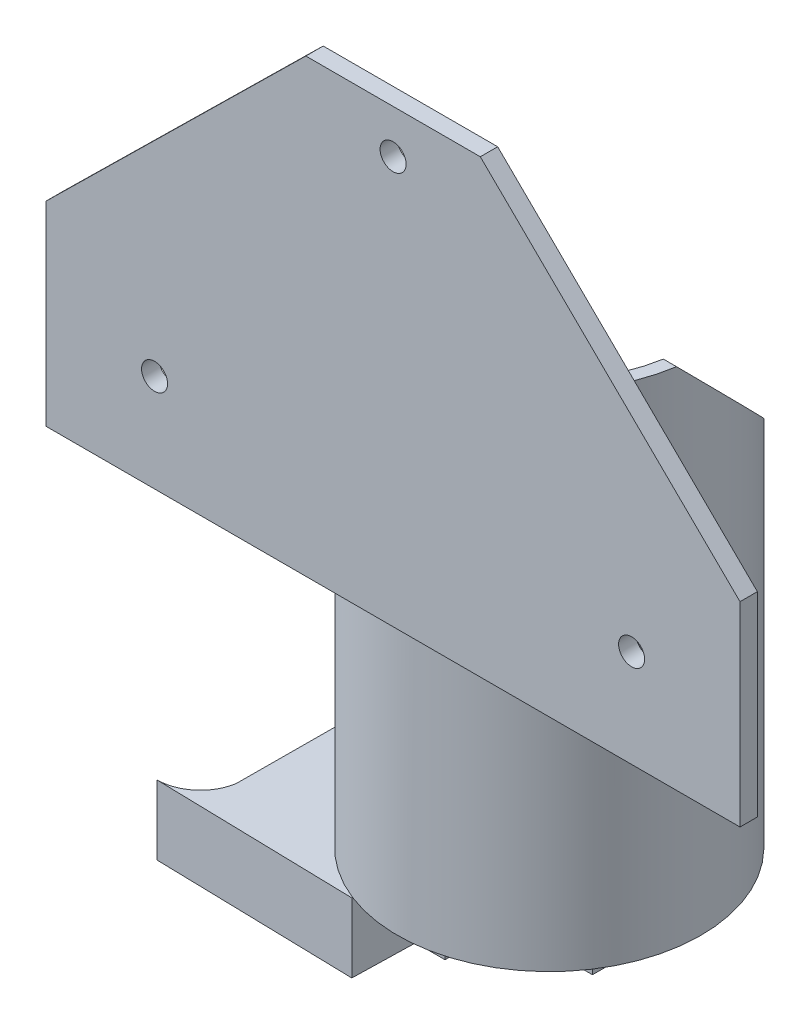
from build123d import *

# Parameters (mm, degrees)
BOSS_EXTRUDE1_DEPTH      = 53
BOSS_EXTRUDE1_DEPTH_BACK = 5
SKETCH1_R                = 17.5
SKETCH2_R                = 16
CUT_EXTRUDE1_DEPTH       = 108
SKETCH3_W                = 25
SKETCH3_H                = 20
CUT_EXTRUDE2_DEPTH       = 108
CUT_EXTRUDE3_DEPTH       = 108
CUT_EXTRUDE3_DEPTH_BACK  = 108
BOSS_EXTRUDE2_DEPTH      = 2
SKETCH10_R               = 1.5
CUT_EXTRUDE4_DEPTH       = 16
BOSS_EXTRUDE3_DEPTH      = 8
BOSS_EXTRUDE5_DEPTH      = 18
BOSS_EXTRUDE5_DEPTH_BACK = 4
SKETCH13_R               = 1.500172947
BOSS_EXTRUDE6_DEPTH      = 8


with BuildPart() as part:
    # Sketch1 → Boss-Extrude1 (new, two sides: drawn at the far end of the back side and taken through both)
    with BuildSketch(Plane(origin=(0, 0, 0), x_dir=(1, 0, 0), z_dir=(0, 1, 0)).offset(-BOSS_EXTRUDE1_DEPTH_BACK)):
        Circle(SKETCH1_R)
    extrude(amount=BOSS_EXTRUDE1_DEPTH + BOSS_EXTRUDE1_DEPTH_BACK)

    # Sketch2 → Cut-Extrude1 (cut)
    with BuildSketch(Plane(origin=(0, 53, 0), x_dir=(1, 0, 0), z_dir=(0, 1, 0))):
        Circle(SKETCH2_R)
    extrude(amount=-CUT_EXTRUDE1_DEPTH, mode=Mode.SUBTRACT)

    # Sketch3 → Cut-Extrude2 (cut)
    with BuildSketch(Plane(origin=(0, 53, 0), x_dir=(1, 0, 0), z_dir=(0, 1, 0))):
        with Locations((0, 16)):
            Rectangle(SKETCH3_W, SKETCH3_H)
    extrude(amount=-CUT_EXTRUDE2_DEPTH, mode=Mode.SUBTRACT)

    # Sketch7 → Cut-Extrude3 (cut, two sides: drawn at the far end of the back side and taken through both)
    with BuildSketch(Plane(origin=(0, 0, 0), x_dir=(0, 0, -1), z_dir=(1, 0, 0)).offset(-CUT_EXTRUDE3_DEPTH_BACK)):
        Polygon((12.247448714, 53), (12.247448714, 38), (-2.626275643, 53), align=None)
    extrude(amount=CUT_EXTRUDE3_DEPTH + CUT_EXTRUDE3_DEPTH_BACK, mode=Mode.SUBTRACT)

    # Sketch8 → Boss-Extrude2 (add)
    with BuildSketch(Plane.XY.offset(18)):
        Polygon((10.05709572, 78.023156751), (40, 48.571119754), (40, 26.071119754), (0, 26.071119754), (-40, 26.071119754), (-40, 48.571119754), (-10.05709572, 78.023156751), align=None)
    extrude(amount=-BOSS_EXTRUDE2_DEPTH)

    # Sketch10 → Cut-Extrude4 (cut)
    with BuildSketch(Plane(origin=(0, 0, 16), x_dir=(-1, 0, 0), z_dir=(0, 0, -1))):
        with Locations((-27.5, 37.321119754)):
            Circle(SKETCH10_R)
        with Locations((27.5, 37.321119754)):
            Circle(SKETCH10_R)
        with Locations((0, 73)):
            Circle(SKETCH10_R)
    extrude(amount=-CUT_EXTRUDE4_DEPTH, mode=Mode.SUBTRACT)

    # Sketch11 → Boss-Extrude3 (add)
    with BuildSketch(Plane.XZ.offset(5)):
        with BuildLine():
            Line((-6.390882144, -8.863379027), (-6.480237612, -11.760990645))
            ThreePointArc((-6.480237612, -11.760990645), (-7.33967567, -12.860163004), (-8.724622378, -13.029680754))
            ThreePointArc((-8.724622378, -13.029680754), (-13.107641391, -18.70255332), (-9.931897769, -25.129604841))
            ThreePointArc((-9.931897769, -25.129604841), (-9.756819698, -26.038761874), (-10.275891909, -26.805431868))
            Line((-10.275891909, -26.805431868), (-18.890882144, -26.863380934))
            Line((-18.890882144, -26.863380934), (-18.890882144, -23.863377119))
            Line((-18.890882144, -23.863377119), (-28.890882144, -23.863377119))
            Line((-28.890882144, -23.863377119), (-28.890882144, -16.863377119))
            Line((-28.890882144, -16.863377119), (-31.890882144, -16.863377119))
            ThreePointArc((-31.890882144, -16.863377119), (-29.928759086, -7.76088478), (-24.390882144, -0.275084044))
            Line((-24.390882144, -0.275084044), (-24.452405581, 11.618795847))
            ThreePointArc((-24.452405581, 11.618795847), (-26.143620347, 14.638664645), (-29.390882144, 15.836623644))
            Line((-29.390882144, 15.836623644), (-6.375618396, 16.386397999))
            Line((-6.375618396, 16.386397999), (-6.012446141, 1.182878311))
            Line((-6.012446141, 1.182878311), (-6.390882144, -8.863379027))
        make_face()
    extrude(amount=BOSS_EXTRUDE3_DEPTH)


with BuildPart() as body_2:
    # Sketch12 → Boss-Extrude5 (new, two sides: drawn at the far end of the back side and taken through both)
    with BuildSketch(Plane.XZ.offset(13).offset(-BOSS_EXTRUDE5_DEPTH_BACK)):
        Polygon((-31.890882144, -26.863380934), (-18.890882144, -26.863380934), (-18.890882144, -23.863377119), (-28.890882144, -23.863377119), (-28.890882144, -16.863377119), (-31.890882144, -16.863377119), align=None)
    extrude(amount=BOSS_EXTRUDE5_DEPTH + BOSS_EXTRUDE5_DEPTH_BACK)

    # Sketch13 → Boss-Extrude6 (add)
    with BuildSketch(Plane.XZ.offset(31)):
        Polygon((-44.322698898, -26.807587047), (-18.822698898, -26.807587047), (-18.822698898, -23.807583233), (-28.822698898, -23.807583233), (-28.822698898, -16.807583233), (-44.322698898, -16.807583233), align=None)
        with Locations((-39.936045011, -19.607691517)):
            Circle(SKETCH13_R, mode=Mode.SUBTRACT)
    extrude(amount=BOSS_EXTRUDE6_DEPTH)


solid = Compound([part.part, body_2.part])
